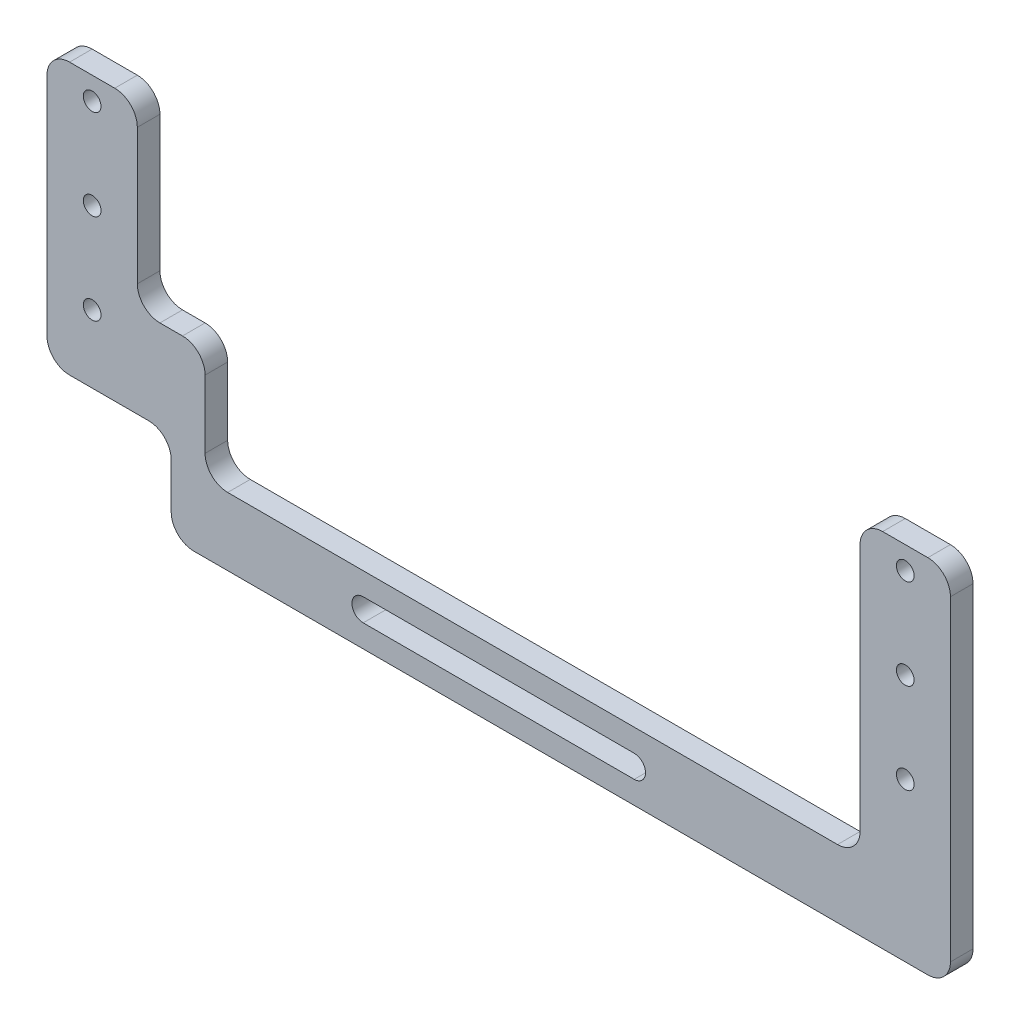
from build123d import *

# Parameters (mm, degrees)
BOSS_EXTRUDE2_DEPTH = 6.35
FILLET1_R           = 6.35
SKETCH2_R           = 2.4892
CUT_EXTRUDE1_DEPTH  = 204.913109234


with BuildPart() as part:
    # Sketch1 → Boss-Extrude2 (new body)
    with BuildSketch(Plane.XY):
        Polygon((77.314761179, 0), (51.914761179, 0), (51.914761179, -82.55), (-132.235238821, -82.55), (-132.235238821, -50.8), (-151.285238821, -50.8), (-151.285238821, 0), (-176.685238821, 0), (-176.685238821, -76.2), (-141.760238821, -76.2), (-141.760238821, -101.6), (51.914761179, -101.6), (77.314761179, -101.6), align=None)
        with BuildLine():
            ThreePointArc((-87.785238821, -95.25), (-90.960238821, -92.075), (-87.785238821, -88.9))
            Line((-87.785238821, -88.9), (-11.585238821, -88.9))
            ThreePointArc((-11.585238821, -88.9), (-8.410238821, -92.075), (-11.585238821, -95.25))
            Line((-11.585238821, -95.25), (-87.785238821, -95.25))
        make_face(mode=Mode.SUBTRACT)
    extrude(amount=BOSS_EXTRUDE2_DEPTH)

    # Fillet1
    fillet1_edges = [part.edges().sort_by_distance(p)[0] for p in [
        (-176.685238821, 0, 3.175),
        (-151.285238821, 0, 3.175),
        (-151.285238821, -50.8, 3.175),
        (-132.235238821, -50.8, 3.175),
        (-132.235238821, -82.55, 3.175),
        (51.914761179, 0, 3.175),
        (77.314761179, 0, 3.175),
        (-141.760238821, -101.6, 3.175),
        (-141.760238821, -76.2, 3.175),
        (-176.685238821, -76.2, 3.175),
        (51.914761179, -82.55, 3.175),
        (77.314761179, -101.6, 3.175),
    ]]
    fillet(fillet1_edges, radius=FILLET1_R)

    # Sketch2 → Cut-Extrude1 (cut, through all)
    with BuildSketch(Plane.XY.offset(6.35)):
        with Locations((64.614761179, -6.35)):
            Circle(SKETCH2_R)
        with Locations((64.614761179, -31.75)):
            Circle(SKETCH2_R)
        with Locations((64.614761179, -57.15)):
            Circle(SKETCH2_R)
        with Locations((-163.985238821, -6.35)):
            Circle(SKETCH2_R)
        with Locations((-163.985238821, -31.75)):
            Circle(SKETCH2_R)
        with Locations((-163.985238821, -57.15)):
            Circle(SKETCH2_R)
    extrude(amount=-CUT_EXTRUDE1_DEPTH, mode=Mode.SUBTRACT)


solid = part.part
